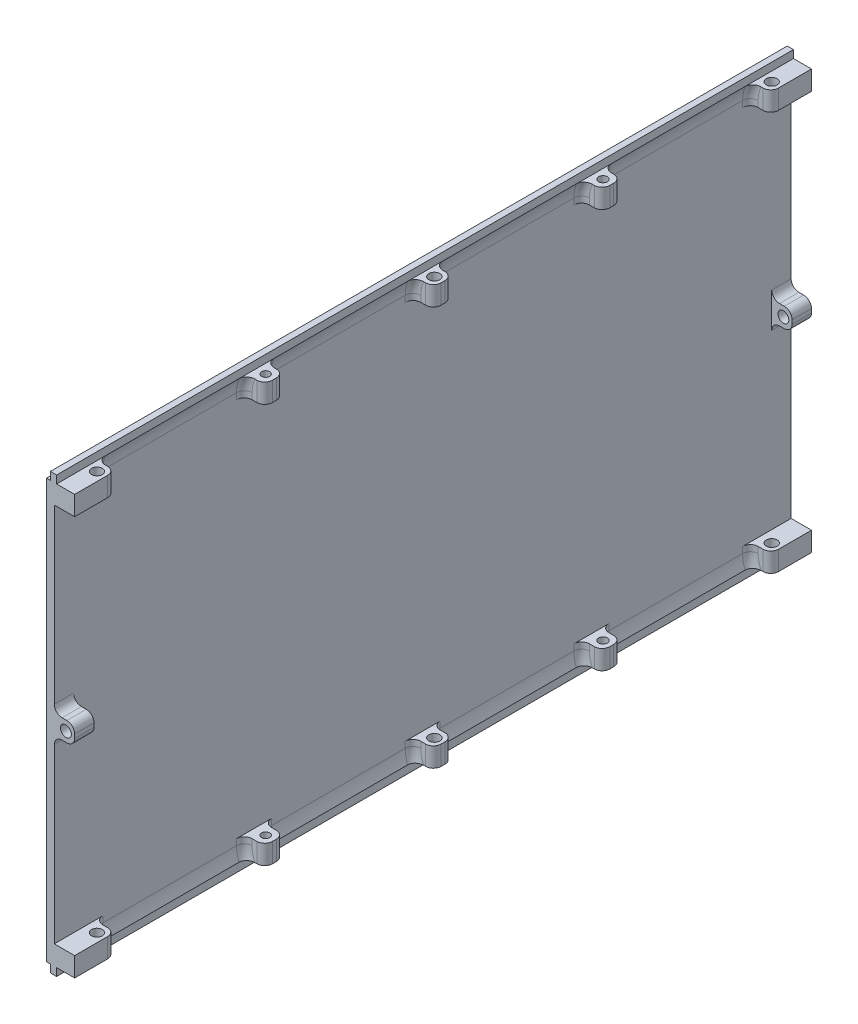
from build123d import *

# Parameters (mm, degrees)
SKETCH1_W            = 190
SKETCH1_H            = 108
BOSS_EXTRUDE1_DEPTH  = 2
SKETCH2_W            = 5.5
SKETCH2_H            = 5
SKETCH2_W_2          = 5
BOSS_EXTRUDE2_DEPTH  = 5.25
SKETCH3_R            = 1.4
CUT_EXTRUDE1_DEPTH   = 198.908281053
SKETCH4_R            = 1.4
SKETCH4_R_2          = 1.132925056
SKETCH4_R_3          = 1.05004708
CUT_EXTRUDE2_DEPTH   = 5
CUT_EXTRUDE3_START   = -103
SKETCH4_2_R          = 1.4
SKETCH4_2_R_2        = 1.132925056
SKETCH4_2_R_3        = 1.05004708
CUT_EXTRUDE3_DEPTH   = 5
SKETCH5_W            = 1.6
SKETCH5_H            = 190
BOSS_EXTRUDE3_DEPTH  = 2
SKETCH6_W            = 1.6
SKETCH6_H            = 190
BOSS_EXTRUDE18_DEPTH = 2
FILLET1_R            = 10
FILLET2_R            = 10
FILLET3_R            = 2
FILLET4_R            = 2


with BuildPart() as part:
    # Sketch1 → Boss-Extrude1 (new body)
    with BuildSketch(Plane(origin=(0, 0, 0), x_dir=(0, 0, -1), z_dir=(1, 0, 0))):
        with Locations((-0.286718598, 0.910155793)):
            Rectangle(SKETCH1_W, SKETCH1_H)
    extrude(amount=BOSS_EXTRUDE1_DEPTH)

    # Sketch2 → Boss-Extrude2 (add)
    with BuildSketch(Plane(origin=(2, 0, 0), x_dir=(0, 0, -1), z_dir=(1, 0, 0))):
        with Locations((-92.536718598, -50.589844207)):
            Rectangle(SKETCH2_W, SKETCH2_H)
        with Locations((-87.286718598, -50.589844207)):
            Rectangle(SKETCH2_W_2, SKETCH2_H)
        with Locations((-92.786718598, 0.910155793)):
            Rectangle(SKETCH2_W_2, SKETCH2_H)
        with Locations((-92.536718598, 52.410155793)):
            Rectangle(SKETCH2_W, SKETCH2_H)
        with Locations((-87.286718598, 52.410155793)):
            Rectangle(SKETCH2_W_2, SKETCH2_H)
        with Locations((-0.286718598, 52.410155793)):
            Rectangle(SKETCH2_W_2, SKETCH2_H)
        with Locations((86.713281402, 52.410155793)):
            Rectangle(SKETCH2_W_2, SKETCH2_H)
        with Locations((91.963281402, 52.410155793)):
            Rectangle(SKETCH2_W, SKETCH2_H)
        with Locations((92.213281402, 0.910155793)):
            Rectangle(SKETCH2_W_2, SKETCH2_H)
        with Locations((-0.286718598, -50.589844207)):
            Rectangle(SKETCH2_W_2, SKETCH2_H)
        with Locations((86.713281402, -50.589844207)):
            Rectangle(SKETCH2_W_2, SKETCH2_H)
        with Locations((91.963281402, -50.589844207)):
            Rectangle(SKETCH2_W, SKETCH2_H)
        with Locations((-43.786718598, 52.410155793)):
            Rectangle(SKETCH2_W_2, SKETCH2_H)
        with Locations((43.213281402, 52.410155793)):
            Rectangle(SKETCH2_W_2, SKETCH2_H)
        with Locations((-43.786718598, -50.589844207)):
            Rectangle(SKETCH2_W_2, SKETCH2_H)
        with Locations((43.213281402, -50.589844207)):
            Rectangle(SKETCH2_W_2, SKETCH2_H)
    extrude(amount=BOSS_EXTRUDE2_DEPTH)

    # Sketch3 → Cut-Extrude1 (cut, through all)
    with BuildSketch(Plane.XY.offset(95.286718598)):
        with Locations((5, 0.910155793)):
            Circle(SKETCH3_R)
    extrude(amount=-CUT_EXTRUDE1_DEPTH, mode=Mode.SUBTRACT)

    # Sketch4 → Cut-Extrude2 (cut)
    with BuildSketch(Plane(origin=(0, 54.910155793, 0), x_dir=(1, 0, 0), z_dir=(0, 1, 0))):
        with Locations(Location((5, -0.286718598, 0), (0, 0, 270))):
            Circle(SKETCH4_R)
        with Locations(Location((5, -87.286718598, 0), (0, 0, 270))):
            Circle(SKETCH4_R)
        with Locations(Location((5, 86.713281402, 0), (0, 0, 270))):
            Circle(SKETCH4_R)
        with Locations(Location((5, 43.213281402, 0), (0, 0, 270))):
            Circle(SKETCH4_R_2)
        with Locations(Location((5, -43.786718598, 0), (0, 0, 270))):
            Circle(SKETCH4_R_3)
    extrude(amount=-CUT_EXTRUDE2_DEPTH, mode=Mode.SUBTRACT)

    # Sketch4<2> → Cut-Extrude3 (cut)
    with BuildSketch(Plane(origin=(0, 54.910155793, 0), x_dir=(1, 0, 0), z_dir=(0, 1, 0)).offset(CUT_EXTRUDE3_START)):
        with Locations(Location((5, -0.286718598, 0), (0, 0, 270))):
            Circle(SKETCH4_2_R)
        with Locations(Location((5, -87.286718598, 0), (0, 0, 270))):
            Circle(SKETCH4_2_R)
        with Locations(Location((5, 86.713281402, 0), (0, 0, 270))):
            Circle(SKETCH4_2_R)
        with Locations(Location((5, 43.213281402, 0), (0, 0, 270))):
            Circle(SKETCH4_2_R_2)
        with Locations(Location((5, -43.786718598, 0), (0, 0, 270))):
            Circle(SKETCH4_2_R_3)
    extrude(amount=-CUT_EXTRUDE3_DEPTH, mode=Mode.SUBTRACT)

    # Sketch5 → Boss-Extrude3 (add)
    with BuildSketch(Plane(origin=(0, 54.910155793, 0), x_dir=(1, 0, 0), z_dir=(0, 1, 0))):
        with Locations((1.8, -0.286718598)):
            Rectangle(SKETCH5_W, SKETCH5_H)
    extrude(amount=BOSS_EXTRUDE3_DEPTH)

    # Sketch6 → Boss-Extrude18 (add)
    with BuildSketch(Plane.XZ.offset(53.089844207)):
        with Locations((1.8, 0.286718598)):
            Rectangle(SKETCH6_W, SKETCH6_H)
    extrude(amount=BOSS_EXTRUDE18_DEPTH)

    # Fillet1
    # the kernel refuses this fillet: 10 mm, written as the material it adds along each edge
    with BuildSketch(Plane(origin=(2, 54.910155793, -37.183920348), x_dir=(0, -1, 0), z_dir=(0, 0, -1))) as fillet1_piece_1_section:
        with BuildLine():
            CenterArc((3.411744422, -10), FILLET1_R, 90, 19.948443589)
            Line((0, -0.6), (0, 0))
            Line((0, 0), (3.411744422, 0))
        make_face()
    fillet1_piece_1 = extrude(amount=55.558722109, mode=Mode.PRIVATE)
    fillet1_piece_1 = split(fillet1_piece_1, bisect_by=Plane(origin=(2.131444483, 53.23392628, -40.713281402), z_dir=(0, 0, -1)), keep=Keep.TOP, mode=Mode.PRIVATE)
    add(fillet1_piece_1)
    with BuildSketch(Plane(origin=(2, 54.910155793, 49.816079652), x_dir=(0, -1, 0), z_dir=(0, 0, -1))) as fillet1_piece_2_section:
        with BuildLine():
            CenterArc((3.411744422, -10), FILLET1_R, 90, 19.948443589)
            Line((0, -0.6), (0, 0))
            Line((0, 0), (3.411744422, 0))
        make_face()
    fillet1_piece_2 = extrude(amount=47.029361055, mode=Mode.PRIVATE)
    fillet1_piece_2 = split(fillet1_piece_2, bisect_by=Plane(origin=(2.131444483, 53.23392628, 46.286718598), z_dir=(0, 0, -1)), keep=Keep.TOP, mode=Mode.PRIVATE)
    add(fillet1_piece_2)
    with BuildSketch(Plane(origin=(2, -53.089844207, -49.242642457), x_dir=(0, 1, 0), z_dir=(0, 0, 1))) as fillet1_piece_3_section:
        with BuildLine():
            CenterArc((3.411744422, -10), FILLET1_R, 90, 19.948443589)
            Line((0, -0.6), (0, 0))
            Line((0, 0), (3.411744422, 0))
        make_face()
    fillet1_piece_3 = extrude(amount=47.029361055, mode=Mode.PRIVATE)
    fillet1_piece_3 = split(fillet1_piece_3, bisect_by=Plane(origin=(2.131444483, -51.413614694, -45.713281402), z_dir=(0, 0, 1)), keep=Keep.TOP, mode=Mode.PRIVATE)
    add(fillet1_piece_3)
    with BuildSketch(Plane(origin=(2, -53.089844207, 37.757357543), x_dir=(0, 1, 0), z_dir=(0, 0, 1))) as fillet1_piece_4_section:
        with BuildLine():
            CenterArc((3.411744422, -10), FILLET1_R, 90, 19.948443589)
            Line((0, -0.6), (0, 0))
            Line((0, 0), (3.411744422, 0))
        make_face()
    fillet1_piece_4 = extrude(amount=55.558722109, mode=Mode.PRIVATE)
    fillet1_piece_4 = split(fillet1_piece_4, bisect_by=Plane(origin=(2.131444483, -51.413614694, 41.286718598), z_dir=(0, 0, 1)), keep=Keep.TOP, mode=Mode.PRIVATE)
    add(fillet1_piece_4)

    # Fillet2
    # the kernel refuses this fillet: 10 mm, written as the material it adds along each edge
    with BuildSketch(Plane(origin=(2, -53.089844207, -92.742642457), x_dir=(1, 0, 0), z_dir=(0, 0, 1)), Plane(origin=(2, -53.089844207, -5.742642457), x_dir=(1, 0, 0), z_dir=(0, 0, 1)), Plane(origin=(2, 54.910155793, 6.316079652), x_dir=(1, 0, 0), z_dir=(0, 0, -1)), Plane(origin=(2, 54.910155793, 93.316079652), x_dir=(1, 0, 0), z_dir=(0, 0, -1))) as fillet2_piece_1:
        with BuildLine():
            CenterArc((10, 3.411744422), FILLET2_R, 180, 19.948443589)
            Line((0, 3.411744422), (-0.2, 3.411744422))
            Line((-0.2, 3.411744422), (-0.2, 0))
            Line((-0.2, 0), (0, -0.2))
            ThreePointArc((0, -0.2), (0.3, -0.2), (0.412, -0.068234888))
            Line((0.412, -0.068234888), (0.6, 0))
        make_face()
    extrude(amount=55.558722109)

    # Fillet3
    fillet3_edges = [part.edges().sort_by_distance(p)[0] for p in [
        (7.25, -1.589844207, -92.213281402),
        (7.25, 3.410155793, -92.213281402),
        (7.25, 52.410155793, 84.786718598),
        (7.25, -1.589844207, 92.786718598),
        (7.25, 3.410155793, 92.786718598),
        (7.25, -50.589844207, 84.786718598),
        (7.25, -50.589844207, -84.213281402),
        (7.25, -50.589844207, -45.713281402),
        (7.25, -50.589844207, -40.713281402),
        (7.25, -50.589844207, -2.213281402),
        (7.25, -50.589844207, 2.786718598),
        (7.25, -50.589844207, 41.286718598),
        (7.25, -50.589844207, 46.286718598),
        (7.25, 52.410155793, -84.213281402),
        (7.25, 52.410155793, -45.713281402),
        (7.25, 52.410155793, -40.713281402),
        (7.25, 52.410155793, -2.213281402),
        (7.25, 52.410155793, 2.786718598),
        (7.25, 52.410155793, 41.286718598),
        (7.25, 52.410155793, 46.286718598),
    ]]
    fillet(fillet3_edges, radius=FILLET3_R)

    # Fillet4
    # the kernel refuses this fillet: 2 mm, written as the material it adds along each edge
    with BuildSketch(Plane(origin=(2, -49.678099785, -45.713281402), x_dir=(0, 0, -1), z_dir=(0, 1, 0)), Plane(origin=(2, -49.678099785, -2.213281402), x_dir=(0, 0, -1), z_dir=(0, 1, 0)), Plane(origin=(2, -49.678099785, 41.286718598), x_dir=(0, 0, -1), z_dir=(0, 1, 0)), Plane(origin=(2, -49.678099785, 84.786718598), x_dir=(0, 0, -1), z_dir=(0, 1, 0)), Plane(origin=(2, 49.910155793, -45.713281402), x_dir=(0, 0, -1), z_dir=(0, 1, 0)), Plane(origin=(2, 49.910155793, -2.213281402), x_dir=(0, 0, -1), z_dir=(0, 1, 0)), Plane(origin=(2, 49.910155793, 41.286718598), x_dir=(0, 0, -1), z_dir=(0, 1, 0)), Plane(origin=(2, 49.910155793, 84.786718598), x_dir=(0, 0, -1), z_dir=(0, 1, 0)), Plane(origin=(2, -48.089844207, -84.213281402), x_dir=(0, 0, 1), z_dir=(0, -1, 0)), Plane(origin=(2, -48.089844207, 2.786718598), x_dir=(0, 0, 1), z_dir=(0, -1, 0)), Plane(origin=(2, -48.089844207, 46.286718598), x_dir=(0, 0, 1), z_dir=(0, -1, 0)), Plane(origin=(2, 51.498411371, -84.213281402), x_dir=(0, 0, 1), z_dir=(0, -1, 0)), Plane(origin=(2, 51.498411371, -40.713281402), x_dir=(0, 0, 1), z_dir=(0, -1, 0)), Plane(origin=(2, 51.498411371, 2.786718598), x_dir=(0, 0, 1), z_dir=(0, -1, 0)), Plane(origin=(2, 51.498411371, 46.286718598), x_dir=(0, 0, 1), z_dir=(0, -1, 0))) as fillet4_piece_1:
        with BuildLine():
            CenterArc((FILLET4_R, -FILLET4_R), FILLET4_R, 90, 90)
            Line((0, -FILLET4_R), (0, 0))
            Line((0, 0), (FILLET4_R, 0))
        make_face()
    extrude(amount=1.588255578)
    with BuildSketch(Plane(origin=(12, -49.678099785, -45.713281402), x_dir=(-0.6613524680061755, -0.7500752715975514, 0), z_dir=(0.7500752715975514, -0.6613524680061755, 0))) as fillet4_piece_2_section:
        with BuildLine():
            CenterArc((10 - FILLET4_R, FILLET4_R), FILLET4_R, 270, 90)
            Line((10, FILLET4_R), (10, 0))
            Line((10, 0), (10 - FILLET4_R, 0))
        make_face()
    fillet4_piece_2 = revolve(axis=Axis((12, -49.678099785, -45.713281402), (0, 0, -1)), revolution_arc=48.596898569, mode=Mode.PRIVATE)
    fillet4_piece_2 = split(fillet4_piece_2, bisect_by=Plane(origin=(3.06743465, -53.089844207, -45.94526162), z_dir=(0, 1, 0)), keep=Keep.TOP, mode=Mode.PRIVATE)
    fillet4_piece_2 = split(fillet4_piece_2, bisect_by=Plane(origin=(2.6, -51.740588392, -45.94526162), z_dir=(1, 0, 0)), keep=Keep.TOP, mode=Mode.PRIVATE)
    add(fillet4_piece_2)
    with BuildSketch(Plane(origin=(12, -49.678099785, -45.713281402), x_dir=(-0.6613524680061755, -0.7500752715975514, 0), z_dir=(0.7500752715975514, -0.6613524680061755, 0))) as fillet4_piece_3_section:
        with BuildLine():
            CenterArc((10 - FILLET4_R, FILLET4_R), FILLET4_R, 270, 90)
            Line((10, FILLET4_R), (10, 0))
            Line((10, 0), (10 - FILLET4_R, 0))
        make_face()
    fillet4_piece_3 = revolve(axis=Axis((12, -49.678099785, -45.713281402), (0, 0, -1)), revolution_arc=48.596898569, mode=Mode.PRIVATE)
    fillet4_piece_3 = split(fillet4_piece_3, bisect_by=Plane(origin=(2.308197816, -53.089844207, -46.361240288), z_dir=(0, 1, 0)), keep=Keep.TOP, mode=Mode.PRIVATE)
    fillet4_piece_3 = split(fillet4_piece_3, bisect_by=Plane(origin=(2.6, -51.103644203, -46.361240288), z_dir=(-1, 0, 0)), keep=Keep.TOP, mode=Mode.PRIVATE)
    add(fillet4_piece_3)
    with BuildSketch(Plane(origin=(12, -49.678099785, -2.213281402), x_dir=(-1, 0, 0), z_dir=(0, 1, 0))) as fillet4_piece_4_section:
        with BuildLine():
            CenterArc((10 - FILLET4_R, -FILLET4_R), FILLET4_R, 0, 90)
            Line((10 - FILLET4_R, 0), (10, 0))
            Line((10, 0), (10, -FILLET4_R))
        make_face()
    fillet4_piece_4 = revolve(axis=Axis((12, -49.678099785, -2.213281402), (0, 0, 1)), revolution_arc=48.596898569, mode=Mode.PRIVATE)
    fillet4_piece_4 = split(fillet4_piece_4, bisect_by=Plane(origin=(2.6, -51.1036444, -2.861240117), z_dir=(-1, 0, 0)), keep=Keep.TOP, mode=Mode.PRIVATE)
    fillet4_piece_4 = split(fillet4_piece_4, bisect_by=Plane(origin=(2.308197915, -53.089844207, -2.861240117), z_dir=(0, 1, 0)), keep=Keep.TOP, mode=Mode.PRIVATE)
    add(fillet4_piece_4)
    with BuildSketch(Plane(origin=(12, -49.678099785, -2.213281402), x_dir=(-1, 0, 0), z_dir=(0, 1, 0))) as fillet4_piece_5_section:
        with BuildLine():
            CenterArc((10 - FILLET4_R, -FILLET4_R), FILLET4_R, 0, 90)
            Line((10 - FILLET4_R, 0), (10, 0))
            Line((10, 0), (10, -FILLET4_R))
        make_face()
    fillet4_piece_5 = revolve(axis=Axis((12, -49.678099785, -2.213281402), (0, 0, 1)), revolution_arc=48.596898569, mode=Mode.PRIVATE)
    fillet4_piece_5 = split(fillet4_piece_5, bisect_by=Plane(origin=(2.6, -51.740587461, -2.445264386), z_dir=(1, 0, 0)), keep=Keep.TOP, mode=Mode.PRIVATE)
    fillet4_piece_5 = split(fillet4_piece_5, bisect_by=Plane(origin=(3.067433212, -53.089844207, -2.445264386), z_dir=(0, 1, 0)), keep=Keep.TOP, mode=Mode.PRIVATE)
    add(fillet4_piece_5)
    with BuildSketch(Plane(origin=(12, -49.678099785, 41.286718598), x_dir=(-0.6613524680061755, -0.7500752715975514, 0), z_dir=(0.7500752715975514, -0.6613524680061755, 0))) as fillet4_piece_6_section:
        with BuildLine():
            CenterArc((10 - FILLET4_R, FILLET4_R), FILLET4_R, 270, 90)
            Line((10 - FILLET4_R, 0), (10, 0))
            Line((10, 0), (10, FILLET4_R))
        make_face()
    fillet4_piece_6 = revolve(axis=Axis((12, -49.678099785, 41.286718598), (0, 0, -1)), revolution_arc=48.596898569, mode=Mode.PRIVATE)
    fillet4_piece_6 = split(fillet4_piece_6, bisect_by=Plane(origin=(2.6, -51.740587568, 41.054738558), z_dir=(1, 0, 0)), keep=Keep.TOP, mode=Mode.PRIVATE)
    fillet4_piece_6 = split(fillet4_piece_6, bisect_by=Plane(origin=(3.067434205, -53.089844207, 41.054738558), z_dir=(0, 1, 0)), keep=Keep.TOP, mode=Mode.PRIVATE)
    add(fillet4_piece_6)
    with BuildSketch(Plane(origin=(12, -49.678099785, 41.286718598), x_dir=(-0.6613524680061755, -0.7500752715975514, 0), z_dir=(0.7500752715975514, -0.6613524680061755, 0))) as fillet4_piece_7_section:
        with BuildLine():
            CenterArc((10 - FILLET4_R, FILLET4_R), FILLET4_R, 270, 90)
            Line((10 - FILLET4_R, 0), (10, 0))
            Line((10, 0), (10, FILLET4_R))
        make_face()
    fillet4_piece_7 = revolve(axis=Axis((12, -49.678099785, 41.286718598), (0, 0, -1)), revolution_arc=48.596898569, mode=Mode.PRIVATE)
    fillet4_piece_7 = split(fillet4_piece_7, bisect_by=Plane(origin=(2.6, -51.10364448, 40.638759734), z_dir=(-1, 0, 0)), keep=Keep.TOP, mode=Mode.PRIVATE)
    fillet4_piece_7 = split(fillet4_piece_7, bisect_by=Plane(origin=(2.308197929, -53.089844207, 40.638759734), z_dir=(0, 1, 0)), keep=Keep.TOP, mode=Mode.PRIVATE)
    add(fillet4_piece_7)
    with BuildSketch(Plane(origin=(12, -49.678099785, 84.786718598), x_dir=(-0.6613524680060716, -0.7500752715976431, 0), z_dir=(0.7500752715976431, -0.6613524680060716, 0))) as fillet4_piece_8_section:
        with BuildLine():
            CenterArc((10 - FILLET4_R, FILLET4_R), FILLET4_R, 270, 90)
            Line((10 - FILLET4_R, 0), (10, 0))
            Line((10, 0), (10, FILLET4_R))
        make_face()
    fillet4_piece_8 = revolve(axis=Axis((12, -49.678099785, 84.786718598), (0, 0, -1)), revolution_arc=48.596898569, mode=Mode.PRIVATE)
    fillet4_piece_8 = split(fillet4_piece_8, bisect_by=Plane(origin=(2.6, -51.740587568, 84.554738558), z_dir=(1, 0, 0)), keep=Keep.TOP, mode=Mode.PRIVATE)
    fillet4_piece_8 = split(fillet4_piece_8, bisect_by=Plane(origin=(3.067434205, -53.089844207, 84.554738558), z_dir=(0, 1, 0)), keep=Keep.TOP, mode=Mode.PRIVATE)
    add(fillet4_piece_8)
    with BuildSketch(Plane(origin=(12, -49.678099785, 84.786718598), x_dir=(-0.6613524680060716, -0.7500752715976431, 0), z_dir=(0.7500752715976431, -0.6613524680060716, 0))) as fillet4_piece_9_section:
        with BuildLine():
            CenterArc((10 - FILLET4_R, FILLET4_R), FILLET4_R, 270, 90)
            Line((10 - FILLET4_R, 0), (10, 0))
            Line((10, 0), (10, FILLET4_R))
        make_face()
    fillet4_piece_9 = revolve(axis=Axis((12, -49.678099785, 84.786718598), (0, 0, -1)), revolution_arc=48.596898569, mode=Mode.PRIVATE)
    fillet4_piece_9 = split(fillet4_piece_9, bisect_by=Plane(origin=(2.6, -51.10364448, 84.138759734), z_dir=(-1, 0, 0)), keep=Keep.TOP, mode=Mode.PRIVATE)
    fillet4_piece_9 = split(fillet4_piece_9, bisect_by=Plane(origin=(2.308197929, -53.089844207, 84.138759734), z_dir=(0, 1, 0)), keep=Keep.TOP, mode=Mode.PRIVATE)
    add(fillet4_piece_9)
    with BuildSketch(Plane(origin=(2, -1.589844207, -89.713281402), x_dir=(0, -1, 0), z_dir=(0, 0, -1)), Plane(origin=(2, -1.589844207, 95.286718598), x_dir=(0, -1, 0), z_dir=(0, 0, -1)), Plane(origin=(2, 3.410155793, 90.286718598), x_dir=(0, 1, 0), z_dir=(0, 0, 1)), Plane(origin=(2, 3.410155793, -94.713281402), x_dir=(0, 1, 0), z_dir=(0, 0, 1))) as fillet4_piece_10:
        with BuildLine():
            CenterArc((FILLET4_R, -FILLET4_R), FILLET4_R, 90, 90)
            Line((0, -FILLET4_R), (0, 0))
            Line((0, 0), (FILLET4_R, 0))
        make_face()
    extrude(amount=5)
    with BuildSketch(Plane(origin=(12, 51.498411371, -45.713281402), x_dir=(-0.6613524680060842, 0.750075271597632, 0), z_dir=(0.750075271597632, 0.6613524680060842, 0))) as fillet4_piece_11_section:
        with BuildLine():
            CenterArc((10 - FILLET4_R, -FILLET4_R), FILLET4_R, 0, 90)
            Line((10, -FILLET4_R), (10, 0))
            Line((10, 0), (10 - FILLET4_R, 0))
        make_face()
    fillet4_piece_11 = revolve(axis=Axis((12, 51.498411371, -45.713281402), (0, 0, 1)), revolution_arc=48.596898569, mode=Mode.PRIVATE)
    fillet4_piece_11 = split(fillet4_piece_11, bisect_by=Plane(origin=(3.067434694, 54.910155793, -45.945261958), z_dir=(0, -1, 0)), keep=Keep.TOP, mode=Mode.PRIVATE)
    fillet4_piece_11 = split(fillet4_piece_11, bisect_by=Plane(origin=(2.6, 53.560900516, -45.945261958), z_dir=(1, 0, 0)), keep=Keep.TOP, mode=Mode.PRIVATE)
    add(fillet4_piece_11)
    with BuildSketch(Plane(origin=(12, 51.498411371, -45.713281402), x_dir=(-0.6613524680060842, 0.750075271597632, 0), z_dir=(0.750075271597632, 0.6613524680060842, 0))) as fillet4_piece_12_section:
        with BuildLine():
            CenterArc((10 - FILLET4_R, -FILLET4_R), FILLET4_R, 0, 90)
            Line((10, -FILLET4_R), (10, 0))
            Line((10, 0), (10 - FILLET4_R, 0))
        make_face()
    fillet4_piece_12 = revolve(axis=Axis((12, 51.498411371, -45.713281402), (0, 0, 1)), revolution_arc=48.596898569, mode=Mode.PRIVATE)
    fillet4_piece_12 = split(fillet4_piece_12, bisect_by=Plane(origin=(2.308197816, 54.910155793, -46.361240288), z_dir=(0, -1, 0)), keep=Keep.TOP, mode=Mode.PRIVATE)
    fillet4_piece_12 = split(fillet4_piece_12, bisect_by=Plane(origin=(2.6, 52.923955789, -46.361240288), z_dir=(-1, 0, 0)), keep=Keep.TOP, mode=Mode.PRIVATE)
    add(fillet4_piece_12)
    with BuildSketch(Plane(origin=(12, 51.498411371, -2.213281402), x_dir=(-0.6613524680061755, 0.7500752715975514, 0), z_dir=(0.7500752715975514, 0.6613524680061755, 0))) as fillet4_piece_13_section:
        with BuildLine():
            CenterArc((10 - FILLET4_R, -FILLET4_R), FILLET4_R, 360, 90)
            Line((10, -FILLET4_R), (10, 0))
            Line((10, 0), (10 - FILLET4_R, 0))
        make_face()
    fillet4_piece_13 = revolve(axis=Axis((12, 51.498411371, -2.213281402), (0, 0, 1)), revolution_arc=48.596898569, mode=Mode.PRIVATE)
    fillet4_piece_13 = split(fillet4_piece_13, bisect_by=Plane(origin=(3.067434694, 54.910155793, -2.445261958), z_dir=(0, -1, 0)), keep=Keep.TOP, mode=Mode.PRIVATE)
    fillet4_piece_13 = split(fillet4_piece_13, bisect_by=Plane(origin=(2.6, 53.560900516, -2.445261958), z_dir=(1, 0, 0)), keep=Keep.TOP, mode=Mode.PRIVATE)
    add(fillet4_piece_13)
    with BuildSketch(Plane(origin=(12, 51.498411371, -2.213281402), x_dir=(-0.6613524680061755, 0.7500752715975514, 0), z_dir=(0.7500752715975514, 0.6613524680061755, 0))) as fillet4_piece_14_section:
        with BuildLine():
            CenterArc((10 - FILLET4_R, -FILLET4_R), FILLET4_R, 360, 90)
            Line((10, -FILLET4_R), (10, 0))
            Line((10, 0), (10 - FILLET4_R, 0))
        make_face()
    fillet4_piece_14 = revolve(axis=Axis((12, 51.498411371, -2.213281402), (0, 0, 1)), revolution_arc=48.596898569, mode=Mode.PRIVATE)
    fillet4_piece_14 = split(fillet4_piece_14, bisect_by=Plane(origin=(2.308197816, 54.910155793, -2.861240288), z_dir=(0, -1, 0)), keep=Keep.TOP, mode=Mode.PRIVATE)
    fillet4_piece_14 = split(fillet4_piece_14, bisect_by=Plane(origin=(2.6, 52.923955789, -2.861240288), z_dir=(-1, 0, 0)), keep=Keep.TOP, mode=Mode.PRIVATE)
    add(fillet4_piece_14)
    with BuildSketch(Plane(origin=(12, 51.498411371, 41.286718598), x_dir=(-0.6613524680060842, 0.750075271597632, 0), z_dir=(0.750075271597632, 0.6613524680060842, 0))) as fillet4_piece_15_section:
        with BuildLine():
            CenterArc((10 - FILLET4_R, -FILLET4_R), FILLET4_R, 0, 90)
            Line((10, -FILLET4_R), (10, 0))
            Line((10, 0), (10 - FILLET4_R, 0))
        make_face()
    fillet4_piece_15 = revolve(axis=Axis((12, 51.498411371, 41.286718598), (0, 0, 1)), revolution_arc=48.596898569, mode=Mode.PRIVATE)
    fillet4_piece_15 = split(fillet4_piece_15, bisect_by=Plane(origin=(3.067434694, 54.910155793, 41.054738042), z_dir=(0, -1, 0)), keep=Keep.TOP, mode=Mode.PRIVATE)
    fillet4_piece_15 = split(fillet4_piece_15, bisect_by=Plane(origin=(2.6, 53.560900516, 41.054738042), z_dir=(1, 0, 0)), keep=Keep.TOP, mode=Mode.PRIVATE)
    add(fillet4_piece_15)
    with BuildSketch(Plane(origin=(12, 51.498411371, 41.286718598), x_dir=(-0.6613524680060842, 0.750075271597632, 0), z_dir=(0.750075271597632, 0.6613524680060842, 0))) as fillet4_piece_16_section:
        with BuildLine():
            CenterArc((10 - FILLET4_R, -FILLET4_R), FILLET4_R, 0, 90)
            Line((10, -FILLET4_R), (10, 0))
            Line((10, 0), (10 - FILLET4_R, 0))
        make_face()
    fillet4_piece_16 = revolve(axis=Axis((12, 51.498411371, 41.286718598), (0, 0, 1)), revolution_arc=48.596898569, mode=Mode.PRIVATE)
    fillet4_piece_16 = split(fillet4_piece_16, bisect_by=Plane(origin=(2.308197816, 54.910155793, 40.638759712), z_dir=(0, -1, 0)), keep=Keep.TOP, mode=Mode.PRIVATE)
    fillet4_piece_16 = split(fillet4_piece_16, bisect_by=Plane(origin=(2.6, 52.923955789, 40.638759712), z_dir=(-1, 0, 0)), keep=Keep.TOP, mode=Mode.PRIVATE)
    add(fillet4_piece_16)
    with BuildSketch(Plane(origin=(12, 51.498411371, 84.786718598), x_dir=(-0.6613524680061755, 0.7500752715975514, 0), z_dir=(0.7500752715975514, 0.6613524680061755, 0))) as fillet4_piece_17_section:
        with BuildLine():
            CenterArc((10 - FILLET4_R, -FILLET4_R), FILLET4_R, 0, 90)
            Line((10, -FILLET4_R), (10, 0))
            Line((10, 0), (10 - FILLET4_R, 0))
        make_face()
    fillet4_piece_17 = revolve(axis=Axis((12, 51.498411371, 84.786718598), (0, 0, 1)), revolution_arc=48.596898569, mode=Mode.PRIVATE)
    fillet4_piece_17 = split(fillet4_piece_17, bisect_by=Plane(origin=(3.067434694, 54.910155793, 84.554738042), z_dir=(0, -1, 0)), keep=Keep.TOP, mode=Mode.PRIVATE)
    fillet4_piece_17 = split(fillet4_piece_17, bisect_by=Plane(origin=(2.6, 53.560900516, 84.554738042), z_dir=(1, 0, 0)), keep=Keep.TOP, mode=Mode.PRIVATE)
    add(fillet4_piece_17)
    with BuildSketch(Plane(origin=(12, 51.498411371, 84.786718598), x_dir=(-0.6613524680061755, 0.7500752715975514, 0), z_dir=(0.7500752715975514, 0.6613524680061755, 0))) as fillet4_piece_18_section:
        with BuildLine():
            CenterArc((10 - FILLET4_R, -FILLET4_R), FILLET4_R, 0, 90)
            Line((10, -FILLET4_R), (10, 0))
            Line((10, 0), (10 - FILLET4_R, 0))
        make_face()
    fillet4_piece_18 = revolve(axis=Axis((12, 51.498411371, 84.786718598), (0, 0, 1)), revolution_arc=48.596898569, mode=Mode.PRIVATE)
    fillet4_piece_18 = split(fillet4_piece_18, bisect_by=Plane(origin=(2.308197816, 54.910155793, 84.138759712), z_dir=(0, -1, 0)), keep=Keep.TOP, mode=Mode.PRIVATE)
    fillet4_piece_18 = split(fillet4_piece_18, bisect_by=Plane(origin=(2.6, 52.923955789, 84.138759712), z_dir=(-1, 0, 0)), keep=Keep.TOP, mode=Mode.PRIVATE)
    add(fillet4_piece_18)
    with BuildSketch(Plane(origin=(12, -49.678099785, -84.213281402), x_dir=(-0.6613524680061755, -0.7500752715975514, 0), z_dir=(0.7500752715975514, -0.6613524680061755, 0))) as fillet4_piece_19_section:
        with BuildLine():
            CenterArc((10 - FILLET4_R, -FILLET4_R), FILLET4_R, 0, 90)
            Line((10, -FILLET4_R), (10, 0))
            Line((10, 0), (10 - FILLET4_R, 0))
        make_face()
    fillet4_piece_19 = revolve(axis=Axis((12, -49.678099785, -84.213281402), (0, 0, -1)), revolution_arc=48.596898569, mode=Mode.PRIVATE)
    fillet4_piece_19 = split(fillet4_piece_19, bisect_by=Plane(origin=(2.6, -51.740587765, -83.981300295), z_dir=(1, 0, 0)), keep=Keep.TOP, mode=Mode.PRIVATE)
    fillet4_piece_19 = split(fillet4_piece_19, bisect_by=Plane(origin=(3.067434461, -53.089844207, -83.981300295), z_dir=(0, 1, 0)), keep=Keep.TOP, mode=Mode.PRIVATE)
    add(fillet4_piece_19)
    with BuildSketch(Plane(origin=(12, -49.678099785, -84.213281402), x_dir=(-0.6613524680061755, -0.7500752715975514, 0), z_dir=(0.7500752715975514, -0.6613524680061755, 0))) as fillet4_piece_20_section:
        with BuildLine():
            CenterArc((10 - FILLET4_R, -FILLET4_R), FILLET4_R, 0, 90)
            Line((10, -FILLET4_R), (10, 0))
            Line((10, 0), (10 - FILLET4_R, 0))
        make_face()
    fillet4_piece_20 = revolve(axis=Axis((12, -49.678099785, -84.213281402), (0, 0, -1)), revolution_arc=48.596898569, mode=Mode.PRIVATE)
    fillet4_piece_20 = split(fillet4_piece_20, bisect_by=Plane(origin=(2.6, -51.10364408, -83.56532245), z_dir=(-1, 0, 0)), keep=Keep.TOP, mode=Mode.PRIVATE)
    fillet4_piece_20 = split(fillet4_piece_20, bisect_by=Plane(origin=(2.308197864, -53.089844207, -83.56532245), z_dir=(0, 1, 0)), keep=Keep.TOP, mode=Mode.PRIVATE)
    add(fillet4_piece_20)
    with BuildSketch(Plane(origin=(2, -48.089844207, -40.713281402), x_dir=(1, 0, 0), z_dir=(0, -1, 0))) as fillet4_piece_21:
        with BuildLine():
            CenterArc((FILLET4_R, FILLET4_R), FILLET4_R, 180, 90)
            Line((0, FILLET4_R), (0, 0))
            Line((0, 0), (FILLET4_R, 0))
        make_face()
    extrude(amount=1.588255578)
    with BuildSketch(Plane(origin=(12, -49.678099785, -40.713281402), x_dir=(-0.6613524680060716, -0.7500752715976431, 0), z_dir=(0.7500752715976431, -0.6613524680060716, 0))) as fillet4_piece_22_section:
        with BuildLine():
            CenterArc((10 - FILLET4_R, -FILLET4_R), FILLET4_R, 0, 90)
            Line((10, -FILLET4_R), (10, 0))
            Line((10, 0), (10 - FILLET4_R, 0))
        make_face()
    fillet4_piece_22 = revolve(axis=Axis((12, -49.678099785, -40.713281402), (0, 0, -1)), revolution_arc=48.596898569, mode=Mode.PRIVATE)
    fillet4_piece_22 = split(fillet4_piece_22, bisect_by=Plane(origin=(3.067434461, -53.089844207, -40.481300295), z_dir=(0, 1, 0)), keep=Keep.TOP, mode=Mode.PRIVATE)
    fillet4_piece_22 = split(fillet4_piece_22, bisect_by=Plane(origin=(2.6, -51.740587765, -40.481300295), z_dir=(1, 0, 0)), keep=Keep.TOP, mode=Mode.PRIVATE)
    add(fillet4_piece_22)
    with BuildSketch(Plane(origin=(12, -49.678099785, -40.713281402), x_dir=(-0.6613524680060716, -0.7500752715976431, 0), z_dir=(0.7500752715976431, -0.6613524680060716, 0))) as fillet4_piece_23_section:
        with BuildLine():
            CenterArc((10 - FILLET4_R, -FILLET4_R), FILLET4_R, 0, 90)
            Line((10, -FILLET4_R), (10, 0))
            Line((10, 0), (10 - FILLET4_R, 0))
        make_face()
    fillet4_piece_23 = revolve(axis=Axis((12, -49.678099785, -40.713281402), (0, 0, -1)), revolution_arc=48.596898569, mode=Mode.PRIVATE)
    fillet4_piece_23 = split(fillet4_piece_23, bisect_by=Plane(origin=(2.308197864, -53.089844207, -40.06532245), z_dir=(0, 1, 0)), keep=Keep.TOP, mode=Mode.PRIVATE)
    fillet4_piece_23 = split(fillet4_piece_23, bisect_by=Plane(origin=(2.6, -51.10364408, -40.06532245), z_dir=(-1, 0, 0)), keep=Keep.TOP, mode=Mode.PRIVATE)
    add(fillet4_piece_23)
    with BuildSketch(Plane(origin=(12, -49.678099785, 2.786718598), x_dir=(-0.6613524680061755, -0.7500752715975514, 0), z_dir=(0.7500752715975514, -0.6613524680061755, 0))) as fillet4_piece_24_section:
        with BuildLine():
            CenterArc((10 - FILLET4_R, -FILLET4_R), FILLET4_R, 0, 90)
            Line((10, -FILLET4_R), (10, 0))
            Line((10, 0), (10 - FILLET4_R, 0))
        make_face()
    fillet4_piece_24 = revolve(axis=Axis((12, -49.678099785, 2.786718598), (0, 0, -1)), revolution_arc=48.596898569, mode=Mode.PRIVATE)
    fillet4_piece_24 = split(fillet4_piece_24, bisect_by=Plane(origin=(2.6, -51.740587765, 3.018699705), z_dir=(1, 0, 0)), keep=Keep.TOP, mode=Mode.PRIVATE)
    fillet4_piece_24 = split(fillet4_piece_24, bisect_by=Plane(origin=(3.067434461, -53.089844207, 3.018699705), z_dir=(0, 1, 0)), keep=Keep.TOP, mode=Mode.PRIVATE)
    add(fillet4_piece_24)
    with BuildSketch(Plane(origin=(12, -49.678099785, 2.786718598), x_dir=(-0.6613524680061755, -0.7500752715975514, 0), z_dir=(0.7500752715975514, -0.6613524680061755, 0))) as fillet4_piece_25_section:
        with BuildLine():
            CenterArc((10 - FILLET4_R, -FILLET4_R), FILLET4_R, 0, 90)
            Line((10, -FILLET4_R), (10, 0))
            Line((10, 0), (10 - FILLET4_R, 0))
        make_face()
    fillet4_piece_25 = revolve(axis=Axis((12, -49.678099785, 2.786718598), (0, 0, -1)), revolution_arc=48.596898569, mode=Mode.PRIVATE)
    fillet4_piece_25 = split(fillet4_piece_25, bisect_by=Plane(origin=(2.6, -51.10364408, 3.43467755), z_dir=(-1, 0, 0)), keep=Keep.TOP, mode=Mode.PRIVATE)
    fillet4_piece_25 = split(fillet4_piece_25, bisect_by=Plane(origin=(2.308197864, -53.089844207, 3.43467755), z_dir=(0, 1, 0)), keep=Keep.TOP, mode=Mode.PRIVATE)
    add(fillet4_piece_25)
    with BuildSketch(Plane(origin=(12, -49.678099785, 46.286718598), x_dir=(-0.6613524680060716, -0.7500752715976431, 0), z_dir=(0.7500752715976431, -0.6613524680060716, 0))) as fillet4_piece_26_section:
        with BuildLine():
            CenterArc((10 - FILLET4_R, -FILLET4_R), FILLET4_R, 0, 90)
            Line((10, -FILLET4_R), (10, 0))
            Line((10, 0), (10 - FILLET4_R, 0))
        make_face()
    fillet4_piece_26 = revolve(axis=Axis((12, -49.678099785, 46.286718598), (0, 0, -1)), revolution_arc=48.596898569, mode=Mode.PRIVATE)
    fillet4_piece_26 = split(fillet4_piece_26, bisect_by=Plane(origin=(2.6, -51.740587765, 46.518699705), z_dir=(1, 0, 0)), keep=Keep.TOP, mode=Mode.PRIVATE)
    fillet4_piece_26 = split(fillet4_piece_26, bisect_by=Plane(origin=(3.067434461, -53.089844207, 46.518699705), z_dir=(0, 1, 0)), keep=Keep.TOP, mode=Mode.PRIVATE)
    add(fillet4_piece_26)
    with BuildSketch(Plane(origin=(12, -49.678099785, 46.286718598), x_dir=(-0.6613524680060716, -0.7500752715976431, 0), z_dir=(0.7500752715976431, -0.6613524680060716, 0))) as fillet4_piece_27_section:
        with BuildLine():
            CenterArc((10 - FILLET4_R, -FILLET4_R), FILLET4_R, 0, 90)
            Line((10, -FILLET4_R), (10, 0))
            Line((10, 0), (10 - FILLET4_R, 0))
        make_face()
    fillet4_piece_27 = revolve(axis=Axis((12, -49.678099785, 46.286718598), (0, 0, -1)), revolution_arc=48.596898569, mode=Mode.PRIVATE)
    fillet4_piece_27 = split(fillet4_piece_27, bisect_by=Plane(origin=(2.6, -51.10364408, 46.93467755), z_dir=(-1, 0, 0)), keep=Keep.TOP, mode=Mode.PRIVATE)
    fillet4_piece_27 = split(fillet4_piece_27, bisect_by=Plane(origin=(2.308197864, -53.089844207, 46.93467755), z_dir=(0, 1, 0)), keep=Keep.TOP, mode=Mode.PRIVATE)
    add(fillet4_piece_27)
    with BuildSketch(Plane(origin=(12, 51.498411371, -84.213281402), x_dir=(-0.6613524680060842, 0.750075271597632, 0), z_dir=(0.750075271597632, 0.6613524680060842, 0))) as fillet4_piece_28_section:
        with BuildLine():
            CenterArc((10 - FILLET4_R, FILLET4_R), FILLET4_R, 270, 90)
            Line((10 - FILLET4_R, 0), (10, 0))
            Line((10, 0), (10, FILLET4_R))
        make_face()
    fillet4_piece_28 = revolve(axis=Axis((12, 51.498411371, -84.213281402), (0, 0, 1)), revolution_arc=48.596898569, mode=Mode.PRIVATE)
    fillet4_piece_28 = split(fillet4_piece_28, bisect_by=Plane(origin=(2.6, 53.560898461, -83.98130323), z_dir=(1, 0, 0)), keep=Keep.TOP, mode=Mode.PRIVATE)
    fillet4_piece_28 = split(fillet4_piece_28, bisect_by=Plane(origin=(3.067434995, 54.910155793, -83.98130323), z_dir=(0, -1, 0)), keep=Keep.TOP, mode=Mode.PRIVATE)
    add(fillet4_piece_28)
    with BuildSketch(Plane(origin=(12, 51.498411371, -84.213281402), x_dir=(-0.6613524680060842, 0.750075271597632, 0), z_dir=(0.750075271597632, 0.6613524680060842, 0))) as fillet4_piece_29_section:
        with BuildLine():
            CenterArc((10 - FILLET4_R, FILLET4_R), FILLET4_R, 270, 90)
            Line((10 - FILLET4_R, 0), (10, 0))
            Line((10, 0), (10, FILLET4_R))
        make_face()
    fillet4_piece_29 = revolve(axis=Axis((12, 51.498411371, -84.213281402), (0, 0, 1)), revolution_arc=48.596898569, mode=Mode.PRIVATE)
    fillet4_piece_29 = split(fillet4_piece_29, bisect_by=Plane(origin=(2.6, 52.923955509, -83.565322763), z_dir=(-1, 0, 0)), keep=Keep.TOP, mode=Mode.PRIVATE)
    fillet4_piece_29 = split(fillet4_piece_29, bisect_by=Plane(origin=(2.308197767, 54.910155793, -83.565322763), z_dir=(0, -1, 0)), keep=Keep.TOP, mode=Mode.PRIVATE)
    add(fillet4_piece_29)
    with BuildSketch(Plane(origin=(12, 51.498411371, -40.713281402), x_dir=(-0.6613524680061755, 0.7500752715975514, 0), z_dir=(0.7500752715975514, 0.6613524680061755, 0))) as fillet4_piece_30_section:
        with BuildLine():
            CenterArc((10 - FILLET4_R, FILLET4_R), FILLET4_R, 270, 90)
            Line((10 - FILLET4_R, 0), (10, 0))
            Line((10, 0), (10, FILLET4_R))
        make_face()
    fillet4_piece_30 = revolve(axis=Axis((12, 51.498411371, -40.713281402), (0, 0, 1)), revolution_arc=48.596898569, mode=Mode.PRIVATE)
    fillet4_piece_30 = split(fillet4_piece_30, bisect_by=Plane(origin=(2.6, 53.560898461, -40.48130323), z_dir=(1, 0, 0)), keep=Keep.TOP, mode=Mode.PRIVATE)
    fillet4_piece_30 = split(fillet4_piece_30, bisect_by=Plane(origin=(3.067434995, 54.910155793, -40.48130323), z_dir=(0, -1, 0)), keep=Keep.TOP, mode=Mode.PRIVATE)
    add(fillet4_piece_30)
    with BuildSketch(Plane(origin=(12, 51.498411371, -40.713281402), x_dir=(-0.6613524680061755, 0.7500752715975514, 0), z_dir=(0.7500752715975514, 0.6613524680061755, 0))) as fillet4_piece_31_section:
        with BuildLine():
            CenterArc((10 - FILLET4_R, FILLET4_R), FILLET4_R, 270, 90)
            Line((10 - FILLET4_R, 0), (10, 0))
            Line((10, 0), (10, FILLET4_R))
        make_face()
    fillet4_piece_31 = revolve(axis=Axis((12, 51.498411371, -40.713281402), (0, 0, 1)), revolution_arc=48.596898569, mode=Mode.PRIVATE)
    fillet4_piece_31 = split(fillet4_piece_31, bisect_by=Plane(origin=(2.6, 52.923955509, -40.065322763), z_dir=(-1, 0, 0)), keep=Keep.TOP, mode=Mode.PRIVATE)
    fillet4_piece_31 = split(fillet4_piece_31, bisect_by=Plane(origin=(2.308197767, 54.910155793, -40.065322763), z_dir=(0, -1, 0)), keep=Keep.TOP, mode=Mode.PRIVATE)
    add(fillet4_piece_31)
    with BuildSketch(Plane(origin=(12, 51.498411371, 2.786718598), x_dir=(-1, 0, 0), z_dir=(0, -1, 0))) as fillet4_piece_32_section:
        with BuildLine():
            CenterArc((10 - FILLET4_R, -FILLET4_R), FILLET4_R, 0, 90)
            Line((10 - FILLET4_R, 0), (10, 0))
            Line((10, 0), (10, -FILLET4_R))
        make_face()
    fillet4_piece_32 = revolve(axis=Axis((12, 51.498411371, 2.786718598), (0, 0, -1)), revolution_arc=48.596898569, mode=Mode.PRIVATE)
    fillet4_piece_32 = split(fillet4_piece_32, bisect_by=Plane(origin=(2.6, 52.923955429, 3.434677088), z_dir=(-1, 0, 0)), keep=Keep.TOP, mode=Mode.PRIVATE)
    fillet4_piece_32 = split(fillet4_piece_32, bisect_by=Plane(origin=(2.308197753, 54.910155793, 3.434677088), z_dir=(0, -1, 0)), keep=Keep.TOP, mode=Mode.PRIVATE)
    add(fillet4_piece_32)
    with BuildSketch(Plane(origin=(12, 51.498411371, 2.786718598), x_dir=(-1, 0, 0), z_dir=(0, -1, 0))) as fillet4_piece_33_section:
        with BuildLine():
            CenterArc((10 - FILLET4_R, -FILLET4_R), FILLET4_R, 0, 90)
            Line((10 - FILLET4_R, 0), (10, 0))
            Line((10, 0), (10, -FILLET4_R))
        make_face()
    fillet4_piece_33 = revolve(axis=Axis((12, 51.498411371, 2.786718598), (0, 0, -1)), revolution_arc=48.596898569, mode=Mode.PRIVATE)
    fillet4_piece_33 = split(fillet4_piece_33, bisect_by=Plane(origin=(2.6, 53.560898353, 3.018699713), z_dir=(1, 0, 0)), keep=Keep.TOP, mode=Mode.PRIVATE)
    fillet4_piece_33 = split(fillet4_piece_33, bisect_by=Plane(origin=(3.067434002, 54.910155793, 3.018699713), z_dir=(0, -1, 0)), keep=Keep.TOP, mode=Mode.PRIVATE)
    add(fillet4_piece_33)
    with BuildSketch(Plane(origin=(12, 51.498411371, 46.286718598), x_dir=(-0.6613524680061755, 0.7500752715975514, 0), z_dir=(0.7500752715975514, 0.6613524680061755, 0))) as fillet4_piece_34_section:
        with BuildLine():
            CenterArc((10 - FILLET4_R, FILLET4_R), FILLET4_R, 270, 90)
            Line((10 - FILLET4_R, 0), (10, 0))
            Line((10, 0), (10, FILLET4_R))
        make_face()
    fillet4_piece_34 = revolve(axis=Axis((12, 51.498411371, 46.286718598), (0, 0, 1)), revolution_arc=48.596898569, mode=Mode.PRIVATE)
    fillet4_piece_34 = split(fillet4_piece_34, bisect_by=Plane(origin=(2.6, 53.560898461, 46.51869677), z_dir=(1, 0, 0)), keep=Keep.TOP, mode=Mode.PRIVATE)
    fillet4_piece_34 = split(fillet4_piece_34, bisect_by=Plane(origin=(3.067434995, 54.910155793, 46.51869677), z_dir=(0, -1, 0)), keep=Keep.TOP, mode=Mode.PRIVATE)
    add(fillet4_piece_34)
    with BuildSketch(Plane(origin=(12, 51.498411371, 46.286718598), x_dir=(-0.6613524680061755, 0.7500752715975514, 0), z_dir=(0.7500752715975514, 0.6613524680061755, 0))) as fillet4_piece_35_section:
        with BuildLine():
            CenterArc((10 - FILLET4_R, FILLET4_R), FILLET4_R, 270, 90)
            Line((10 - FILLET4_R, 0), (10, 0))
            Line((10, 0), (10, FILLET4_R))
        make_face()
    fillet4_piece_35 = revolve(axis=Axis((12, 51.498411371, 46.286718598), (0, 0, 1)), revolution_arc=48.596898569, mode=Mode.PRIVATE)
    fillet4_piece_35 = split(fillet4_piece_35, bisect_by=Plane(origin=(2.6, 52.923955509, 46.934677237), z_dir=(-1, 0, 0)), keep=Keep.TOP, mode=Mode.PRIVATE)
    fillet4_piece_35 = split(fillet4_piece_35, bisect_by=Plane(origin=(2.308197767, 54.910155793, 46.934677237), z_dir=(0, -1, 0)), keep=Keep.TOP, mode=Mode.PRIVATE)
    add(fillet4_piece_35)


solid = part.part
